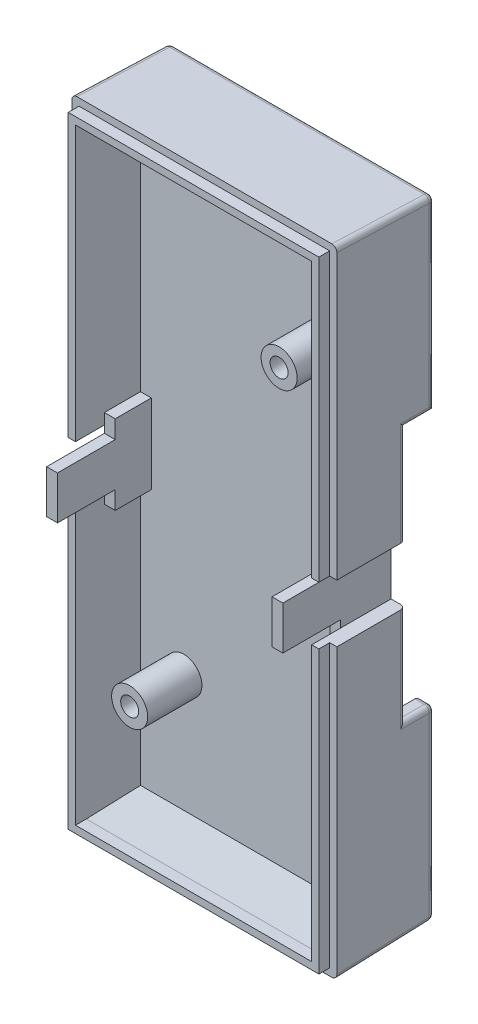
from build123d import *

# Parameters (mm, degrees)
EXTRUDE_1_DEPTH     = 18.35
CUT_EXTRUDE_1_DEPTH = 4
SHELL_START         = -16.36
SHELL_1_DEPTH       = 32.72
SKETCH_8_R          = 2.5
SKETCH_8_R_2        = 1.25
EXTRUDE_4_DEPTH     = 7.51
FILLET_1_R          = 0.7
SKETCH_10_W         = 8.837744534
SKETCH_10_H         = 38.466628308
SKETCH_10_W_2       = 9.721518987
SKETCH_10_H_2       = 38.024741082
CUT_EXTRUDE_2_DEPTH = 4
EXTRUDE_5_DEPTH     = 1.5
EXTRUDE_6_DEPTH     = 1.5


# Read off the part's stored shape, not the designer's step: Оболочка1
with BuildPart() as part:
    # Эскиз1 → Вытянуть1 (new, symmetric)
    with BuildSketch(Plane(origin=(0, 0, 0), x_dir=(0, 0, -1), z_dir=(1, 0, 0))):
        Polygon((-13.5, 44), (0, 43.5), (0, -43.5), (-13.5, -44), align=None)
    extrude(amount=EXTRUDE_1_DEPTH, both=True)

    # Эскиз2 → Вырез-Вытянуть1 (cut)
    with BuildSketch(Plane(origin=(0, 0, 0), x_dir=(-1, 0, 0), z_dir=(0, 0, -1))):
        Polygon((-18.35, 17.65), (-9.3, 17.65), (-9.3, 20), (-16.35, 20), (-16.35, 42), (16.35, 42), (16.35, 20), (9.3, 20), (9.3, 17.65), (18.35, 17.65), (18.35, -17.65), (16.35, -17.65), (16.35, -42), (10, -42), (10, -19.65), (11.35, -19.65), (11.35, -17.65), (6, -17.65), (6, -39.65), (7.5, -39.65), (7.5, -44), (-7.5, -44), (-7.5, -39.65), (-6, -39.65), (-6, -17.65), (-11.35, -17.65), (-11.35, -19.65), (-10, -19.65), (-10, -42), (-16.35, -42), (-16.35, -17.65), (-18.35, -17.65), align=None)
    extrude(amount=-CUT_EXTRUDE_1_DEPTH, mode=Mode.SUBTRACT)

    # Оболочка1 outline → Оболочка1 (cut)
    with BuildSketch(Plane.YZ.offset(SHELL_START)):
        Polygon((-42.008635584, 13.5), (-41.730487436, 5.99), (41.730487436, 5.99), (42.008635584, 13.5), align=None)
    extrude(amount=SHELL_1_DEPTH, mode=Mode.SUBTRACT)

    # Эскиз8 → Вытянуть4 (add)
    # profile 1 of 2: a face of its own
    with BuildSketch(Plane.XY.offset(5.99)):
        with Locations(Location((10.35, 25.5, 0), (0, 0, 180))):
            Circle(SKETCH_8_R)
        with Locations(Location((10.35, 25.5, 0), (0, 0, 180))):
            Circle(SKETCH_8_R_2, mode=Mode.SUBTRACT)
    # profile 2 of 2: a face of its own
    with BuildSketch(Plane.XY.offset(5.99)):
        with Locations(Location((-10.35, -25.5, 0), (0, 0, 180))):
            Circle(SKETCH_8_R)
        with Locations(Location((-10.35, -25.5, 0), (0, 0, 180))):
            Circle(SKETCH_8_R_2, mode=Mode.SUBTRACT)
    extrude(amount=EXTRUDE_4_DEPTH)

    # Скругление1
    fillet_1_edges = [part.edges().sort_by_distance(p)[0] for p in [
        (17.35, -17.65, 0),
        (-18.35, -43.75, 6.75),
        (-18.35, -30.575, 0),
        (-18.35, 0, 4),
        (-18.35, 30.575, 0),
        (18.35, -43.75, 6.75),
        (18.35, -30.575, 0),
        (18.35, -17.65, 2),
        (18.35, 0, 4),
        (18.35, 17.65, 2),
        (18.35, 30.575, 0),
        (-18.35, 43.75, 6.75),
        (0, 43.5, 0),
        (18.35, 43.75, 6.75),
        (-12.925, -43.5, 0),
        (12.925, -43.5, 0),
        (-18.35, 17.65, 2),
    ]]
    fillet(fillet_1_edges, radius=FILLET_1_R)

    # Эскиз10 → Вырез-Вытянуть2 (cut, symmetric)
    with BuildSketch(Plane(origin=(0, 0, 0), x_dir=(1, 0, 0), z_dir=(0, 1, 0))):
        with Locations((-20.778872267, 0)):
            Rectangle(SKETCH_10_W, SKETCH_10_H)
        with Locations((21.220759494, 0)):
            Rectangle(SKETCH_10_W_2, SKETCH_10_H_2)
    extrude(amount=CUT_EXTRUDE_2_DEPTH, both=True, mode=Mode.SUBTRACT)


with BuildPart() as body_2:
    # Эскиз11 → Вытянуть5 (new body)
    with BuildSketch(Plane(origin=(-16.36, 0, 0), x_dir=(0, 0, -1), z_dir=(1, 0, 0))):
        Polygon((-5.99, 5.5), (-10.99, 5.5), (-10.99, 3), (-18.99, 3), (-18.99, -3), (-10.99, -3), (-10.99, -5.5), (-5.99, -5.5), align=None)
    extrude_5 = extrude(amount=EXTRUDE_5_DEPTH)



with BuildPart() as part_1:
    add(part.part)

    # Зеркальное отражение2: Вытянуть5 across plane
    add(extrude_5.mirror(Plane(origin=(0, 0, 0), x_dir=(0, 0, 1), z_dir=(1, 0, 0))))


with BuildPart() as body_2_1:
    add(body_2.part)

    add(part_1.part)  # Вытянуть6 merges part
    # Эскиз12 → Вытянуть6 (add)
    with BuildSketch(Plane.XY.offset(13.5)):
        Polygon((-16.36, 4), (-16.36, 42.008635584), (16.36, 42.008635584), (16.36, 4), (17.36, 4), (17.36, 43.008635584), (-17.36, 43.008635584), (-17.36, 4), align=None)
    extrude_6 = extrude(amount=EXTRUDE_6_DEPTH)

    # Зеркальное отражение3: Вытянуть6 across plane
    add(extrude_6.mirror(Plane.ZX))


solid = body_2_1.part
